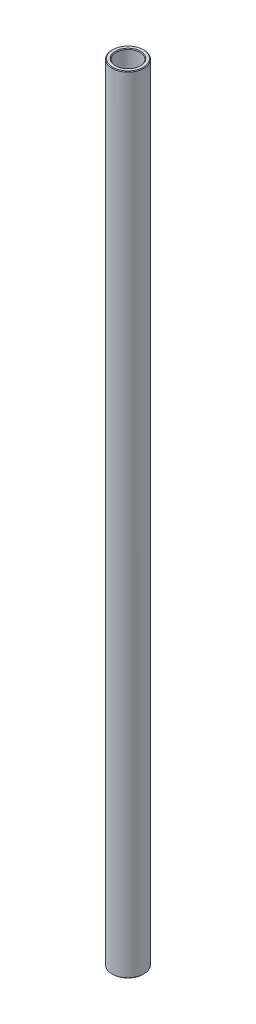
from build123d import *

# Parameters (mm, degrees)
SKETCH1_W     = 1.5875
SKETCH1_H     = 313.53125
CHAMFER1_SIZE = 0.254


with BuildPart() as part:
    # Sketch1 → Revolve1 (revolve)
    with BuildSketch(Plane.XY):
        with Locations((5.55625, 0)):
            Rectangle(SKETCH1_W, SKETCH1_H)
    revolve(axis=Axis((0, 11.60859375, 0), (0, -1, 0)))

    # Chamfer1
    chamfer1_edges = [part.edges().sort_by_distance(p)[0] for p in [
        (-4.7625, -156.765625, 0),
        (-6.35, -156.765625, 0),
        (-6.35, 156.765625, 0),
        (-4.7625, 156.765625, 0),
    ]]
    chamfer(chamfer1_edges, length=CHAMFER1_SIZE)


solid = part.part
